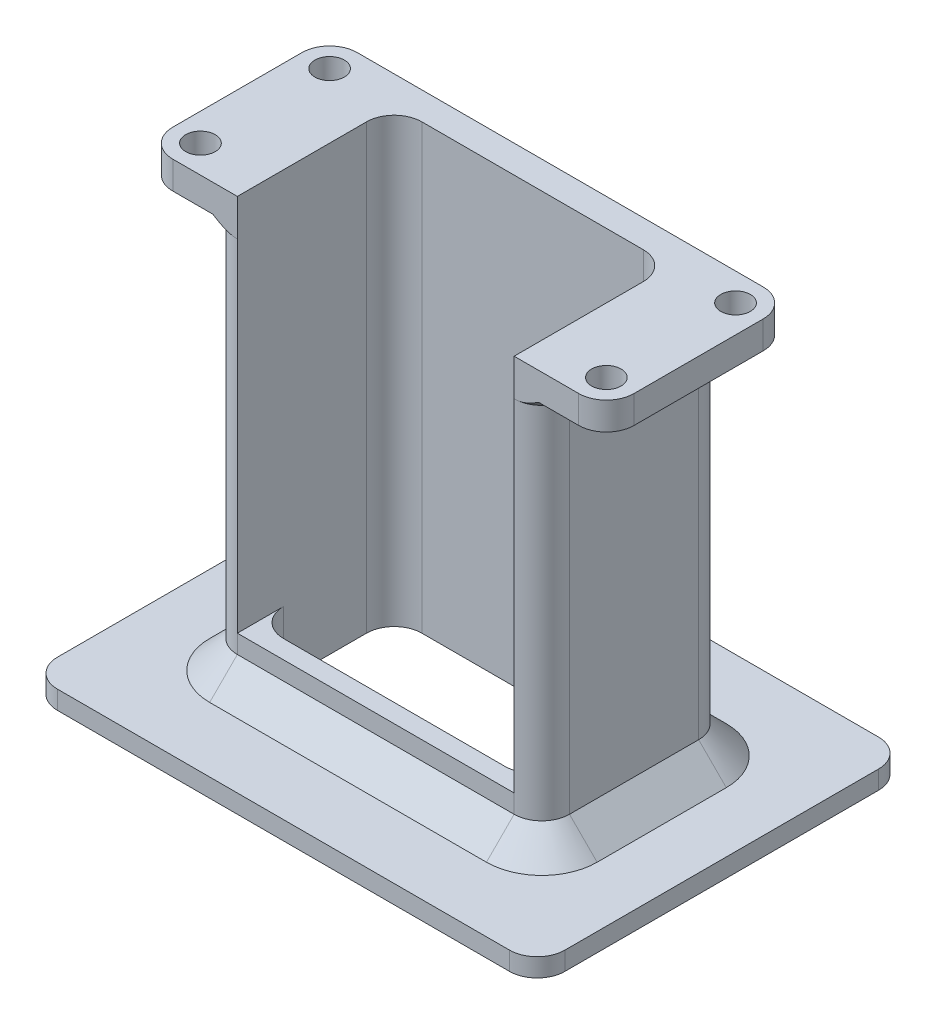
from build123d import *

# Parameters (mm, degrees)
SKETCH_1_W          = 30
SKETCH_1_H          = 3
EXTRUDE_1_DEPTH     = 45
SKETCH_1_3_W        = 7
SKETCH_1_3_H        = 20
SKETCH_1_3_W_2      = 30
SKETCH_1_3_H_2      = 3
EXTRUDE_2_DEPTH     = 3
SKETCH_2_W          = 55
SKETCH_2_H          = 40
EXTRUDE_3_DEPTH     = 2
SKETCH_3_W          = 30
SKETCH_3_H          = 2
EXTRUDE_4_DEPTH     = 5
SKETCH_4_W          = 30
SKETCH_4_H          = 15
CUT_EXTRUDE_1_DEPTH = 58.203583804
CUT_EXTRUDE_2_REACH = 60.824
SKETCH_6_R          = 1.6
FILLET_1_R          = 3
FILLET_2_R          = 3
CHAMFER_1_SIZE      = 3
CHAMFER_2_SIZE      = 1
FILLET_4_R          = 3


# Some blends are built 0.0001 mm under size
with BuildPart() as part:
    # 草图1 → 凸台-拉伸1 (new body)
    with BuildSketch(Plane(origin=(0, 0, 0), x_dir=(1, 0, 0), z_dir=(0, 1, 0))):
        Polygon((18, 10), (15, 10), (15, 7), (15, -10), (18, -10), align=None)
        with Locations((0, 8.5)):
            Rectangle(SKETCH_1_W, SKETCH_1_H)
        Polygon((-15, 7), (-15, 10), (-18, 10), (-18, -10), (-15, -10), align=None)
    extrude(amount=-EXTRUDE_1_DEPTH)

    # 草图1<3> → 凸台-拉伸2 (add)
    with BuildSketch(Plane(origin=(0, 0, 0), x_dir=(1, 0, 0), z_dir=(0, 1, 0))):
        with Locations((-21.5, 0)):
            Rectangle(SKETCH_1_3_W, SKETCH_1_3_H)
        Polygon((-15, 7), (-15, 10), (-18, 10), (-18, -10), (-15, -10), align=None)
        with Locations((0, 8.5)):
            Rectangle(SKETCH_1_3_W_2, SKETCH_1_3_H_2)
        Polygon((18, 10), (15, 10), (15, 7), (15, -10), (18, -10), align=None)
        with Locations((21.5, 0)):
            Rectangle(SKETCH_1_3_W, SKETCH_1_3_H)
    extrude(amount=EXTRUDE_2_DEPTH)

    # 草图2 → 凸台-拉伸3 (add)
    with BuildSketch(Plane.XZ.offset(45)):
        Rectangle(SKETCH_2_W, SKETCH_2_H)
    extrude(amount=-EXTRUDE_3_DEPTH)

    # 草图3 → 凸台-拉伸4 (add)
    with BuildSketch(Plane(origin=(0, -43, 0), x_dir=(1, 0, 0), z_dir=(0, 1, 0))):
        with Locations((0, -9)):
            Rectangle(SKETCH_3_W, SKETCH_3_H)
    extrude(amount=EXTRUDE_4_DEPTH)

    # 草图4 → 切除-拉伸1 (cut, through all)
    with BuildSketch(Plane(origin=(0, -43, 0), x_dir=(1, 0, 0), z_dir=(0, 1, 0))):
        with Locations((0, -0.5)):
            Rectangle(SKETCH_4_W, SKETCH_4_H)
    extrude(amount=-CUT_EXTRUDE_1_DEPTH, mode=Mode.SUBTRACT)

    # 草图6 → 切除-拉伸2 (cut, up to next)
    with BuildSketch(Plane(origin=(0, 3, 0), x_dir=(1, 0, 0), z_dir=(0, 1, 0)), mode=Mode.PRIVATE) as cut_extrude_2_sk1:
        with Locations(Location((-22, -7, 0), (0, 0, 270))):
            Circle(SKETCH_6_R)
    cut_extrude_2_tool1 = extrude(cut_extrude_2_sk1.sketch, amount=-CUT_EXTRUDE_2_REACH, mode=Mode.PRIVATE) & part.part
    # 草图6 → 切除-拉伸2 (cut, up to next)
    with BuildSketch(Plane(origin=(0, 3, 0), x_dir=(1, 0, 0), z_dir=(0, 1, 0)), mode=Mode.PRIVATE) as cut_extrude_2_sk2:
        with Locations(Location((-22, 7, 0), (0, 0, 270))):
            Circle(SKETCH_6_R)
    cut_extrude_2_tool2 = extrude(cut_extrude_2_sk2.sketch, amount=-CUT_EXTRUDE_2_REACH, mode=Mode.PRIVATE) & part.part
    # 草图6 → 切除-拉伸2 (cut, up to next)
    with BuildSketch(Plane(origin=(0, 3, 0), x_dir=(1, 0, 0), z_dir=(0, 1, 0)), mode=Mode.PRIVATE) as cut_extrude_2_sk3:
        with Locations(Location((22, -7, 0), (0, 0, 270))):
            Circle(SKETCH_6_R)
    cut_extrude_2_tool3 = extrude(cut_extrude_2_sk3.sketch, amount=-CUT_EXTRUDE_2_REACH, mode=Mode.PRIVATE) & part.part
    # 草图6 → 切除-拉伸2 (cut, up to next)
    with BuildSketch(Plane(origin=(0, 3, 0), x_dir=(1, 0, 0), z_dir=(0, 1, 0)), mode=Mode.PRIVATE) as cut_extrude_2_sk4:
        with Locations(Location((22, 7, 0), (0, 0, 270))):
            Circle(SKETCH_6_R)
    cut_extrude_2_tool4 = extrude(cut_extrude_2_sk4.sketch, amount=-CUT_EXTRUDE_2_REACH, mode=Mode.PRIVATE) & part.part
    add(cut_extrude_2_tool1.solids().sort_by_distance((-22, 3, 7))[0], mode=Mode.SUBTRACT)
    add(cut_extrude_2_tool2.solids().sort_by_distance((-22, 3, -7))[0], mode=Mode.SUBTRACT)
    add(cut_extrude_2_tool3.solids().sort_by_distance((22, 3, 7))[0], mode=Mode.SUBTRACT)
    add(cut_extrude_2_tool4.solids().sort_by_distance((22, 3, -7))[0], mode=Mode.SUBTRACT)

    # 圆角1
    fillet_1_edges = [part.edges().sort_by_distance(p)[0] for p in [
        (-25, 1.5, 10),
        (25, 1.5, 10),
        (25, 1.5, -10),
        (-25, 1.5, -10),
    ]]
    fillet(fillet_1_edges, radius=FILLET_1_R)

    # 圆角2
    fillet_2_edges = [part.edges().sort_by_distance(p)[0] for p in [
        (-18, -21.5, -10),
        (18, -21.5, -10),
        (-18, -21.5, 10),
        (18, -21.5, 10),
        (27.5, -44, 20),
        (27.5, -44, -20),
        (-27.5, -44, -20),
        (-27.5, -44, 20),
    ]]
    fillet(fillet_2_edges, radius=FILLET_2_R - 0.0001)  # a hair under: the kernel refuses the full size

    # 倒角1
    chamfer_1_edges = [part.edges().sort_by_distance(p)[0] for p in [
        (0, -43, 10),
        (-18, -43, 0),
        (0, -43, -10),
        (18, -43, 0),
        (17.121349633, -43, 9.121349633),
        (-17.121349633, -43, 9.121349633),
        (17.121349633, -43, -9.121349633),
        (-17.121349633, -43, -9.121349633),
    ]]
    chamfer(chamfer_1_edges, length=CHAMFER_1_SIZE)

    # 倒角2
    # the kernel refuses this chamfer: 1 mm, written as the material it adds along each edge
    with BuildSketch(Plane(origin=(18, 0, 7.0001), x_dir=(0.9996219169112968, 0.027495876610586247, 0), z_dir=(0, 0, -1)), Plane(origin=(-18, 0, -7.0001), x_dir=(-0.9996219169112968, 0.02749587661058639, 0), z_dir=(0, 0, 1))) as chamfer_2_piece_1:
        Polygon((CHAMFER_2_SIZE * 0.999621916911, CHAMFER_2_SIZE * 0.0274958766106), (-CHAMFER_2_SIZE * 0.0274958766106, CHAMFER_2_SIZE * 0.999621916911), (0, 0), align=None)
    extrude(amount=14.0002)
    with BuildSketch(Plane(origin=(15.0001, 0, 7.0001), x_dir=(1, 0, 0), z_dir=(0, 0, -1))) as chamfer_2_piece_2_section:
        Polygon((2.9999 + CHAMFER_2_SIZE, 0), (2.9999, CHAMFER_2_SIZE), (2.9999, 0), align=None)
    chamfer_2_piece_2 = revolve(axis=Axis((15.0001, 0, 7.0001), (0, -1, 0)), revolution_arc=139.136895156, mode=Mode.PRIVATE)
    chamfer_2_piece_2 = split(chamfer_2_piece_2, bisect_by=Plane(origin=(18.290229606, -0.281148304, 10), z_dir=(0, 0, -1)), keep=Keep.TOP, mode=Mode.PRIVATE)
    chamfer_2_piece_2 = split(chamfer_2_piece_2, bisect_by=Plane(origin=(15, -0.281148304, 7.827153976), z_dir=(1, 0, 0)), keep=Keep.TOP, mode=Mode.PRIVATE)
    add(chamfer_2_piece_2)
    with BuildSketch(Plane(origin=(-15.0001, 0, 7.0001), x_dir=(-1, 0, 0), z_dir=(0, 0, -1))) as chamfer_2_piece_3_section:
        Polygon((2.9999 + CHAMFER_2_SIZE, 0), (2.9999, -CHAMFER_2_SIZE), (2.9999, 0), align=None)
    chamfer_2_piece_3 = revolve(axis=Axis((-15.0001, 0, 7.0001), (0, 1, 0)), revolution_arc=139.136895156, mode=Mode.PRIVATE)
    chamfer_2_piece_3 = split(chamfer_2_piece_3, bisect_by=Plane(origin=(-18.290229606, -0.281148304, 10), z_dir=(0, 0, -1)), keep=Keep.TOP, mode=Mode.PRIVATE)
    chamfer_2_piece_3 = split(chamfer_2_piece_3, bisect_by=Plane(origin=(-15, -0.281148304, 7.827153976), z_dir=(-1, 0, 0)), keep=Keep.TOP, mode=Mode.PRIVATE)
    add(chamfer_2_piece_3)
    with BuildSketch(Plane(origin=(15.0001, 0, -7.0001), x_dir=(-0.7562749275069748, 0, -0.6542539522420326), z_dir=(-0.6542539522420326, 0, 0.7562749275069748))) as chamfer_2_piece_4_section:
        Polygon((2.9999, CHAMFER_2_SIZE), (2.9999 + CHAMFER_2_SIZE, 0), (2.9999, 0), align=None)
    chamfer_2_piece_4 = revolve(axis=Axis((15.0001, 0, -7.0001), (0, -1, 0)), revolution_arc=139.136895156, mode=Mode.PRIVATE)
    chamfer_2_piece_4 = split(chamfer_2_piece_4, bisect_by=Plane(origin=(17.219196031, -0.376233932, -10), z_dir=(0, 0, 1)), keep=Keep.TOP, mode=Mode.PRIVATE)
    add(chamfer_2_piece_4)
    with BuildSketch(Plane(origin=(-15.0001, 0, -7.0001), x_dir=(0.7562749275069739, 0, -0.6542539522420336), z_dir=(0.6542539522420336, 0, 0.7562749275069739))) as chamfer_2_piece_5_section:
        Polygon((2.9999, -CHAMFER_2_SIZE), (2.9999 + CHAMFER_2_SIZE, 0), (2.9999, 0), align=None)
    chamfer_2_piece_5 = revolve(axis=Axis((-15.0001, 0, -7.0001), (0, 1, 0)), revolution_arc=139.136895156, mode=Mode.PRIVATE)
    chamfer_2_piece_5 = split(chamfer_2_piece_5, bisect_by=Plane(origin=(-17.219196031, -0.376233932, -10), z_dir=(0, 0, 1)), keep=Keep.TOP, mode=Mode.PRIVATE)
    add(chamfer_2_piece_5)

    # 圆角4
    fillet_4_edges = [part.edges().sort_by_distance(p)[0] for p in [
        (-15, -21, -7),
        (15, -21, -7),
        (-15, -41.5, 8),
        (15, -41.5, 8),
    ]]
    fillet(fillet_4_edges, radius=FILLET_4_R)


solid = part.part
